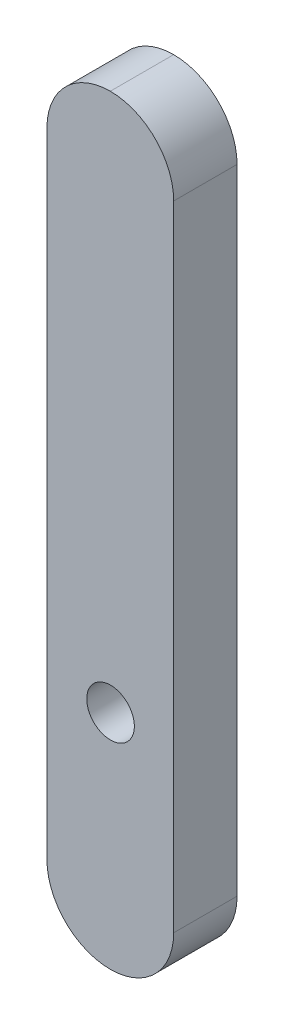
from build123d import *

# Parameters (mm, degrees)
SKETCH1_W           = 12.7
SKETCH1_H           = 76.2
BOSS_EXTRUDE1_DEPTH = 6.35
SKETCH2_R           = 2.383900133
CUT_EXTRUDE1_DEPTH  = 55.651998855
FILLET1_R           = 6.35


with BuildPart() as part:
    # Sketch1 → Boss-Extrude1 (new body)
    with BuildSketch(Plane.XY):
        with Locations((-0.022814859, 15.806453321)):
            Rectangle(SKETCH1_W, SKETCH1_H)
    extrude(amount=BOSS_EXTRUDE1_DEPTH)

    # Sketch2 → Cut-Extrude1 (cut, through all)
    with BuildSketch(Plane(origin=(0, 0, 0), x_dir=(-1, 0, 0), z_dir=(0, 0, -1))):
        Circle(SKETCH2_R)
    extrude(amount=-CUT_EXTRUDE1_DEPTH, mode=Mode.SUBTRACT)

    # Fillet1
    fillet1_edges = [part.edges().sort_by_distance(p)[0] for p in [
        (6.327185141, -22.293546679, 3.175),
        (-6.372814859, -22.293546679, 3.175),
        (6.327185141, 53.906453321, 3.175),
        (-6.372814859, 53.906453321, 3.175),
    ]]
    fillet(fillet1_edges, radius=FILLET1_R - 0.0001)  # a hair under: the kernel refuses the full size


solid = part.part
